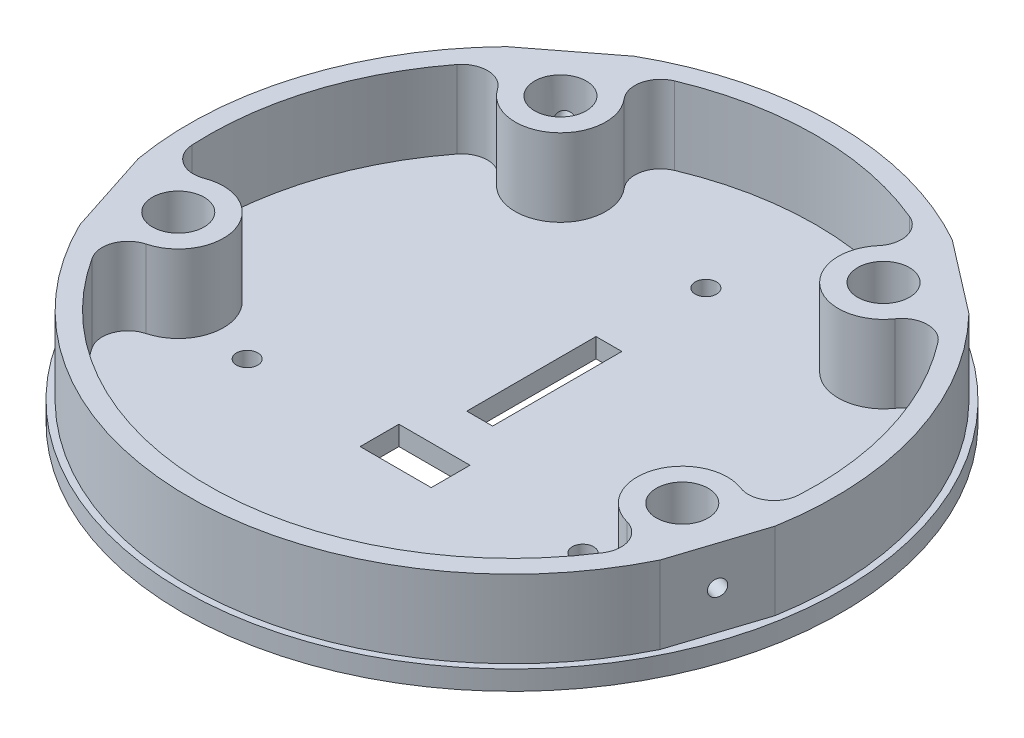
from build123d import *

# Parameters (mm, degrees)
SKETCH_1_R               = 51
EXTRUDE_1_DEPTH          = 3
SKETCH_2_R               = 50
SKETCH_2_R_2             = 47
EXTRUDE_2_DEPTH          = 12
SKETCH_5_R               = 1.65
CUT_EXTRUDE_1_DEPTH      = 10
PATTERN_CIRCULAR_1_COUNT = 3
SKETCH_6_W               = 4
SKETCH_6_H               = 20
SKETCH_6_W_2             = 11
SKETCH_6_H_2             = 6
CUT_EXTRUDE_2_DEPTH      = 10
SKETCH_7_R               = 7
SKETCH_7_R_2             = 4
EXTRUDE_3_DEPTH          = 12
CUT_EXTRUDE_START        = -12
CUT_EXTRUDE_3_DEPTH      = 12
FILLET_1_R               = 4
SKETCH_9_R               = 1.25
CUT_EXTRUDE_4_DEPTH      = 10
SKETCH_10_R              = 1.25
CUT_EXTRUDE_5_DEPTH      = 10


with BuildPart() as part:
    # Эскиз1 → Бобышка-Вытянуть1 (new body)
    with BuildSketch(Plane(origin=(0, 0, 0), x_dir=(1, 0, 0), z_dir=(0, 1, 0))):
        Circle(SKETCH_1_R)
    extrude(amount=EXTRUDE_1_DEPTH)

    # Эскиз2 → Бобышка-Вытянуть2 (add)
    with BuildSketch(Plane(origin=(0, 3, 0), x_dir=(1, 0, 0), z_dir=(0, 1, 0))):
        Circle(SKETCH_2_R)
        Circle(SKETCH_2_R_2, mode=Mode.SUBTRACT)
    extrude(amount=EXTRUDE_2_DEPTH)

    # Эскиз5 → Вырез-Вытянуть1 (cut)
    with BuildSketch(Plane(origin=(0, 3, 0), x_dir=(1, 0, 0), z_dir=(0, 1, 0))):
        with Locations((0, 30)):
            Circle(SKETCH_5_R)
    cut_extrude_1 = extrude(amount=-CUT_EXTRUDE_1_DEPTH, mode=Mode.SUBTRACT)

    # Круговой массив1: Вырез-Вытянуть1 ×3 about axis
    pattern_circular_1_axis = Axis((0, 15, 0), (0, -1, 0))
    for i in range(1, PATTERN_CIRCULAR_1_COUNT):
        add(cut_extrude_1.rotate(pattern_circular_1_axis, i * 360 / PATTERN_CIRCULAR_1_COUNT), mode=Mode.SUBTRACT)

    # Эскиз6 → Вырез-Вытянуть2 (cut)
    with BuildSketch(Plane(origin=(0, 3, 0), x_dir=(1, 0, 0), z_dir=(0, 1, 0))):
        with Locations((0, 5)):
            Rectangle(SKETCH_6_W, SKETCH_6_H)
        with Locations((0, -15)):
            Rectangle(SKETCH_6_W_2, SKETCH_6_H_2)
    extrude(amount=-CUT_EXTRUDE_2_DEPTH, mode=Mode.SUBTRACT)

    # Эскиз7 → Бобышка-Вытянуть3 (add)
    # profile 1 of 4: a face of its own
    with BuildSketch(Plane(origin=(0, 3, 0), x_dir=(1, 0, 0), z_dir=(0, 1, 0))):
        with Locations((-39, -12.649110641)):
            Circle(SKETCH_7_R)
        with Locations((-39, -12.649110641)):
            Circle(SKETCH_7_R_2, mode=Mode.SUBTRACT)
    # profile 2 of 4: a face of its own
    with BuildSketch(Plane(origin=(0, 3, 0), x_dir=(1, 0, 0), z_dir=(0, 1, 0))):
        with Locations((39, -12.649110641)):
            Circle(SKETCH_7_R)
        with Locations((39, -12.649110641)):
            Circle(SKETCH_7_R_2, mode=Mode.SUBTRACT)
    # profile 3 of 4: a face of its own
    with BuildSketch(Plane(origin=(0, 3, 0), x_dir=(1, 0, 0), z_dir=(0, 1, 0))):
        with Locations((-25, 32.496153619)):
            Circle(SKETCH_7_R)
        with Locations((-25, 32.496153619)):
            Circle(SKETCH_7_R_2, mode=Mode.SUBTRACT)
    # profile 4 of 4: a face of its own
    with BuildSketch(Plane(origin=(0, 3, 0), x_dir=(1, 0, 0), z_dir=(0, 1, 0))):
        with Locations((25, 32.496153619)):
            Circle(SKETCH_7_R)
        with Locations((25, 32.496153619)):
            Circle(SKETCH_7_R_2, mode=Mode.SUBTRACT)
    extrude(amount=EXTRUDE_3_DEPTH)

    # Эскиз8 → Вырез-Вытянуть3 (cut)
    with BuildSketch(Plane(origin=(0, 15, 0), x_dir=(1, 0, 0), z_dir=(0, 1, 0)).offset(CUT_EXTRUDE_START)):
        with BuildLine():
            Line((-49.261434929, -8.562185978), (-44.909296778, -21.980788496))
            ThreePointArc((-44.909296778, -21.980788496), (-47.56097561, -15.425744684), (-49.261434929, -8.562185978))
        make_face()
        with BuildLine():
            Line((-35.773349506, 34.932326936), (-24.592504153, 43.533995216))
            ThreePointArc((-24.592504153, 43.533995216), (-30.487804878, 39.629455632), (-35.773349506, 34.932326936))
        make_face()
    cut_extrude_3 = extrude(amount=CUT_EXTRUDE_3_DEPTH, mode=Mode.SUBTRACT)

    # Скругление1
    fillet_1_edges = [part.edges().sort_by_distance(p)[0] for p in [
        (45.746490166, 9, 10.782329872),
        (43.366537793, 9, 18.120248338),
        (25.50476376, 9, -39.477930867),
        (31.618972111, 9, -34.774136979),
        (-31.618972111, 9, -34.774136979),
        (-25.50476376, 9, -39.477930867),
        (-45.746490166, 9, 10.782329872),
        (-43.366537793, 9, 18.120248338),
    ]]
    fillet(fillet_1_edges, radius=FILLET_1_R)

    # Зеркальное отражение1: Вырез-Вытянуть3 across plane
    add(cut_extrude_3.mirror(Plane(origin=(0, 0, 0), x_dir=(0, 0, 1), z_dir=(1, 0, 0))), mode=Mode.SUBTRACT)

    # Эскиз9 → Вырез-Вытянуть4 (cut)
    with BuildSketch(Plane(origin=(-47.085365854, 0, 15.271487237), x_dir=(0.3085148936749628, 0, 0.9512195121951224), z_dir=(-0.9512195121951222, 0, 0.30851489367496276))):
        with Locations((0, 9)):
            Circle(SKETCH_9_R)
    cut_extrude_4 = extrude(amount=-CUT_EXTRUDE_4_DEPTH, mode=Mode.SUBTRACT)

    # Эскиз10 → Вырез-Вытянуть5 (cut)
    with BuildSketch(Plane(origin=(-30.182926829, 0, -39.233161076), x_dir=(-0.7925891126474105, 0, 0.6097560975609759), z_dir=(-0.6097560975609759, 0, -0.7925891126474105))):
        with Locations((0, 9)):
            Circle(SKETCH_10_R)
    cut_extrude_5 = extrude(amount=-CUT_EXTRUDE_5_DEPTH, mode=Mode.SUBTRACT)

    # Зеркальное отражение2: Вырез-Вытянуть4, Вырез-Вытянуть5 across plane
    add(cut_extrude_4.mirror(Plane(origin=(0, 0, 0), x_dir=(0, 0, 1), z_dir=(1, 0, 0))), mode=Mode.SUBTRACT)
    add(cut_extrude_5.mirror(Plane(origin=(0, 0, 0), x_dir=(0, 0, 1), z_dir=(1, 0, 0))), mode=Mode.SUBTRACT)


solid = part.part
